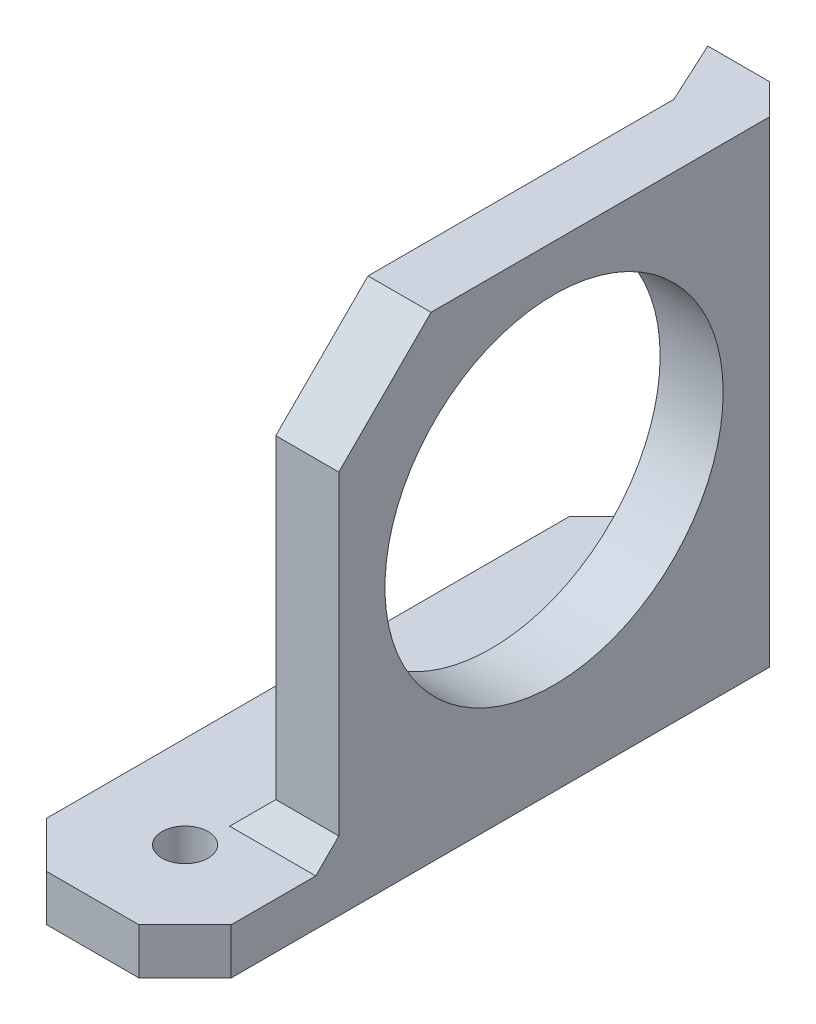
from build123d import *

# Parameters (mm, degrees)
SKETCH1_R           = 1.5
BOSS_EXTRUDE1_DEPTH = 3
BOSS_EXTRUDE2_DEPTH = 28
CHAMFER1_SIZE       = 2
SKETCH4_R           = 11
CUT_EXTRUDE1_DEPTH  = 11
CHAMFER2_SIZE       = 6
CHAMFER3_SIZE       = 1.5


with BuildPart() as part:
    # Sketch1 → Boss-Extrude1 (new body)
    with BuildSketch(Plane(origin=(0, 0, 0), x_dir=(1, 0, 0), z_dir=(0, 1, 0))):
        Polygon((-6, 17), (-3, 20), (6, 20), (6, -17), (3, -20), (-3, -20), (-6, -17), align=None)
        with Locations(Location((0, 14, 0), (0, 0, 270))):
            Circle(SKETCH1_R, mode=Mode.SUBTRACT)
        with Locations(Location((0, -14, 0), (0, 0, 270))):
            Circle(SKETCH1_R, mode=Mode.SUBTRACT)
    extrude(amount=BOSS_EXTRUDE1_DEPTH)

    # Sketch2 → Boss-Extrude2 (add)
    with BuildSketch(Plane(origin=(0, 3, 0), x_dir=(1, 0, 0), z_dir=(0, 1, 0))):
        Polygon((6, -10), (6, 20), (0, 20), (1.9, 15.9), (1.9, -10), align=None)
    extrude(amount=BOSS_EXTRUDE2_DEPTH)

    # Chamfer1
    chamfer1_edges = [part.edges().sort_by_distance(p)[0] for p in [
        (6, 15.5, -20),
    ]]
    chamfer(chamfer1_edges, length=CHAMFER1_SIZE)

    # Sketch4 → Cut-Extrude1 (cut)
    with BuildSketch(Plane(origin=(6, 0, 0), x_dir=(0, 0, -1), z_dir=(1, 0, 0))):
        with Locations((4, 17)):
            Circle(SKETCH4_R)
    extrude(amount=-CUT_EXTRUDE1_DEPTH, mode=Mode.SUBTRACT)

    # Chamfer2
    chamfer2_edges = [part.edges().sort_by_distance(p)[0] for p in [
        (3.95, 31, 10),
    ]]
    chamfer(chamfer2_edges, length=CHAMFER2_SIZE)

    # Chamfer3
    # the kernel refuses this chamfer: 1.5 mm, written as the material it adds along each edge
    with BuildSketch(Plane(origin=(1.9, 3, 10), x_dir=(0, 0.9996219169112968, -0.02749587661058678), z_dir=(1, 0, 0))) as chamfer3_piece_1:
        Polygon((CHAMFER3_SIZE * 0.999621916911, CHAMFER3_SIZE * 0.0274958766106), (-CHAMFER3_SIZE * 0.0274958766106, CHAMFER3_SIZE * 0.999621916911), (0, 0), align=None)
    extrude(amount=4.1)
    with BuildSketch(Plane(origin=(1.9, 3, -19.757524482), x_dir=(0.02749587661058635, 0.9996219169112968, 0), z_dir=(0, 0, 1))) as chamfer3_piece_2_section:
        Polygon((CHAMFER3_SIZE * 0.999621916911, CHAMFER3_SIZE * 0.0274958766106), (-CHAMFER3_SIZE * 0.0274958766106, CHAMFER3_SIZE * 0.999621916911), (0, 0), align=None)
    chamfer3_piece_2 = extrude(amount=29.757524482, mode=Mode.PRIVATE)
    chamfer3_piece_2 = chamfer3_piece_2 - Plane(origin=(0, 3.553768572, -14), x_dir=(0, 0, 1), z_dir=(0, -1, 0)) * Cylinder(1.5, 66, mode=Mode.PRIVATE)
    add(chamfer3_piece_2)
    with BuildSketch(Plane(origin=(1.9, 3, -19.757524482), x_dir=(0.02749587661058635, 0.9996219169112968, 0), z_dir=(0, 0, 1))) as chamfer3_piece_3a_section:
        Polygon((CHAMFER3_SIZE * 0.999621916911, CHAMFER3_SIZE * 0.0274958766106), (-CHAMFER3_SIZE * 0.0274958766106, CHAMFER3_SIZE * 0.999621916911), (0, 0), align=None)
    chamfer3_piece_3a = extrude(amount=33.615048964, mode=Mode.PRIVATE)
    chamfer3_piece_3a = split(chamfer3_piece_3a, bisect_by=Plane(origin=(1.452851003, 3.519674643, 10), z_dir=(0, 0, 1)), keep=Keep.TOP, mode=Mode.PRIVATE)
    chamfer3_piece_3a = chamfer3_piece_3a - Plane(origin=(0, 3.519674643, 14), x_dir=(0, 0, 1), z_dir=(0, -1, 0)) * Cylinder(1.5, 74, mode=Mode.PRIVATE)
    with BuildSketch(Plane(origin=(-1.957524482, 3, 10), x_dir=(0, 0.9996219169112968, -0.02749587661058678), z_dir=(1, 0, 0))) as chamfer3_piece_3b_section:
        Polygon((CHAMFER3_SIZE * 0.999621916911, CHAMFER3_SIZE * 0.0274958766106), (-CHAMFER3_SIZE * 0.0274958766106, CHAMFER3_SIZE * 0.999621916911), (0, 0), align=None)
    chamfer3_piece_3b = extrude(amount=7.957524482, mode=Mode.PRIVATE)
    chamfer3_piece_3b = split(chamfer3_piece_3b, bisect_by=Plane(origin=(1.9, 3.49469044, 10.49469044), z_dir=(-1, 0, 0)), keep=Keep.TOP, mode=Mode.PRIVATE)
    chamfer3_piece_3 = chamfer3_piece_3a & chamfer3_piece_3b
    add(chamfer3_piece_3)


solid = part.part
